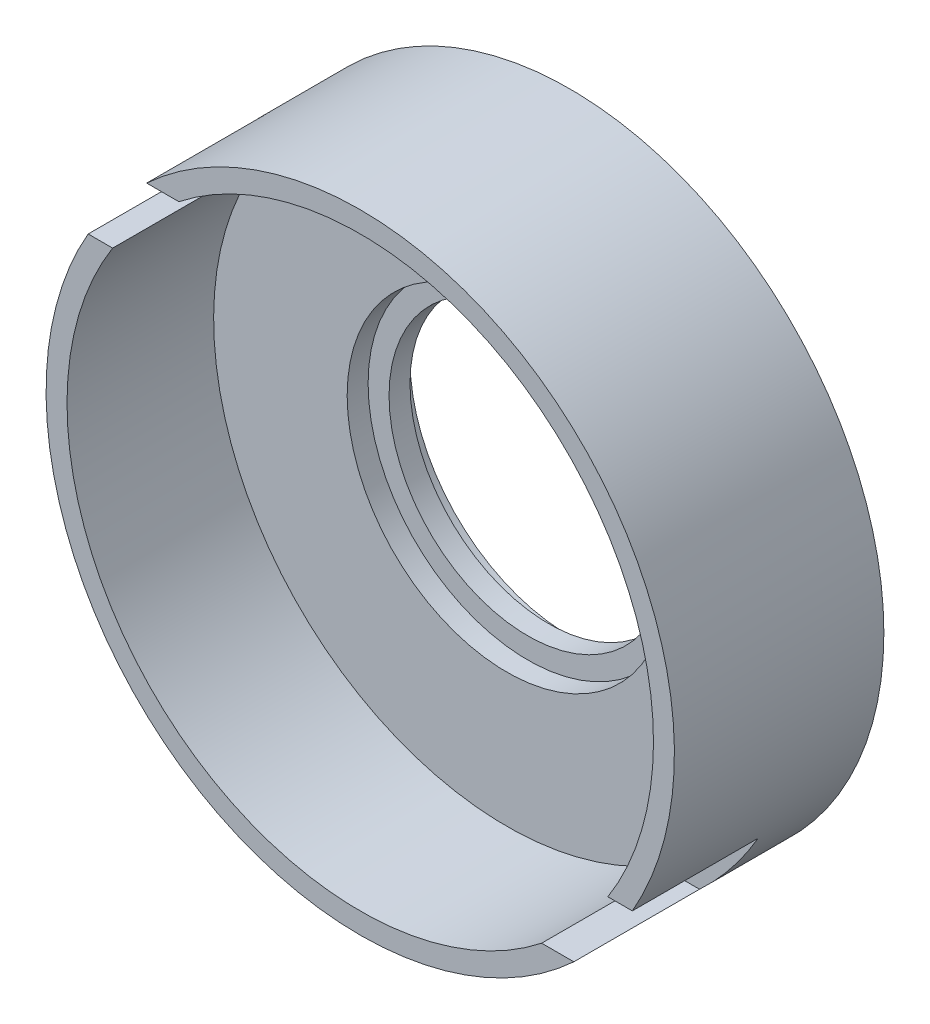
from build123d import *

# Parameters (mm, degrees)
SKETCH_5_R          = 30
EXTRUDE_1_DEPTH     = 20
CUT_EXTRUDE_START   = 6
SKETCH_6_R          = 28
CUT_EXTRUDE_1_DEPTH = 14
SKETCH_7_R          = 13.25
CUT_EXTRUDE_2_DEPTH = 15
CUT_EXTRUDE_START_2 = 4
SKETCH_8_R          = 15.25
CUT_EXTRUDE_3_DEPTH = 16
CUT_EXTRUDE_START_3 = 8
SKETCH_10_W         = 15
SKETCH_10_H         = 7
CUT_EXTRUDE_4_DEPTH = 12
SKETCH_13_W         = 15
SKETCH_13_H         = 7
CUT_EXTRUDE_5_DEPTH = 12
SKETCH_14_R         = 15.25
CUT_EXTRUDE_6_DEPTH = 2


with BuildPart() as part:
    # Эскиз5 → Бобышка-Вытянуть1 (new body)
    with BuildSketch(Plane.XY):
        Circle(SKETCH_5_R)
    extrude(amount=EXTRUDE_1_DEPTH)

    # Эскиз6 → Вырез-Вытянуть1 (cut)
    with BuildSketch(Plane.XY.offset(CUT_EXTRUDE_START)):
        Circle(SKETCH_6_R)
    extrude(amount=CUT_EXTRUDE_1_DEPTH, mode=Mode.SUBTRACT)

    # Эскиз7 → Вырез-Вытянуть2 (cut)
    with BuildSketch(Plane.XY):
        Circle(SKETCH_7_R)
    extrude(amount=CUT_EXTRUDE_2_DEPTH, mode=Mode.SUBTRACT)

    # Эскиз8 → Вырез-Вытянуть3 (cut)
    with BuildSketch(Plane.XY.offset(CUT_EXTRUDE_START_2)):
        Circle(SKETCH_8_R)
    extrude(amount=CUT_EXTRUDE_3_DEPTH, mode=Mode.SUBTRACT)

    # Эскиз10 → Вырез-Вытянуть4 (cut)
    with BuildSketch(Plane.XY.offset(CUT_EXTRUDE_START_3)):
        with Locations((-22.5, 18.5)):
            Rectangle(SKETCH_10_W, SKETCH_10_H)
    extrude(amount=CUT_EXTRUDE_4_DEPTH, mode=Mode.SUBTRACT)

    # Эскиз13 → Вырез-Вытянуть5 (cut)
    with BuildSketch(Plane.XY.offset(CUT_EXTRUDE_START_3)):
        with Locations((22.5, -18.5)):
            Rectangle(SKETCH_13_W, SKETCH_13_H)
    extrude(amount=CUT_EXTRUDE_5_DEPTH, mode=Mode.SUBTRACT)

    # Эскиз14 → Вырез-Вытянуть6 (cut)
    with BuildSketch(Plane.XY):
        Circle(SKETCH_14_R)
    extrude(amount=CUT_EXTRUDE_6_DEPTH, mode=Mode.SUBTRACT)


solid = part.part
